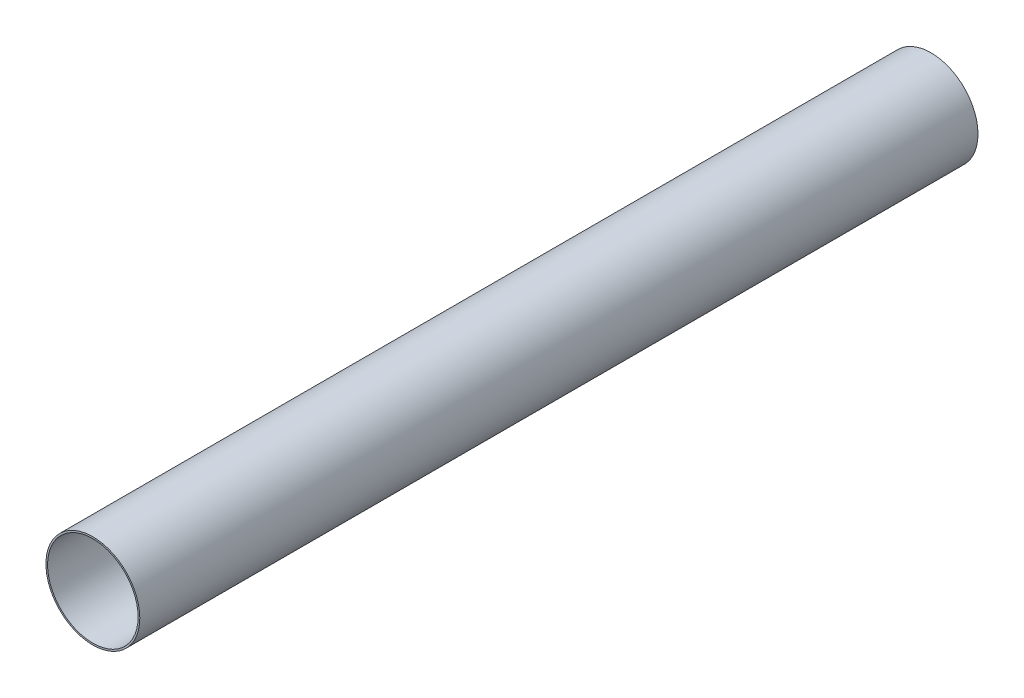
from build123d import *

# Parameters (mm, degrees)
SKETCH1_R           = 14
BOSS_EXTRUDE1_DEPTH = 250
SKETCH2_R           = 13.5
CUT_EXTRUDE1_DEPTH  = 251.782774528


with BuildPart() as part:
    # Sketch1 → Boss-Extrude1 (new body)
    with BuildSketch(Plane.XY):
        Circle(SKETCH1_R)
    extrude(amount=BOSS_EXTRUDE1_DEPTH)

    # Sketch2 → Cut-Extrude1 (cut, through all)
    with BuildSketch(Plane.XY.offset(250)):
        Circle(SKETCH2_R)
    extrude(amount=-CUT_EXTRUDE1_DEPTH, mode=Mode.SUBTRACT)


solid = part.part
